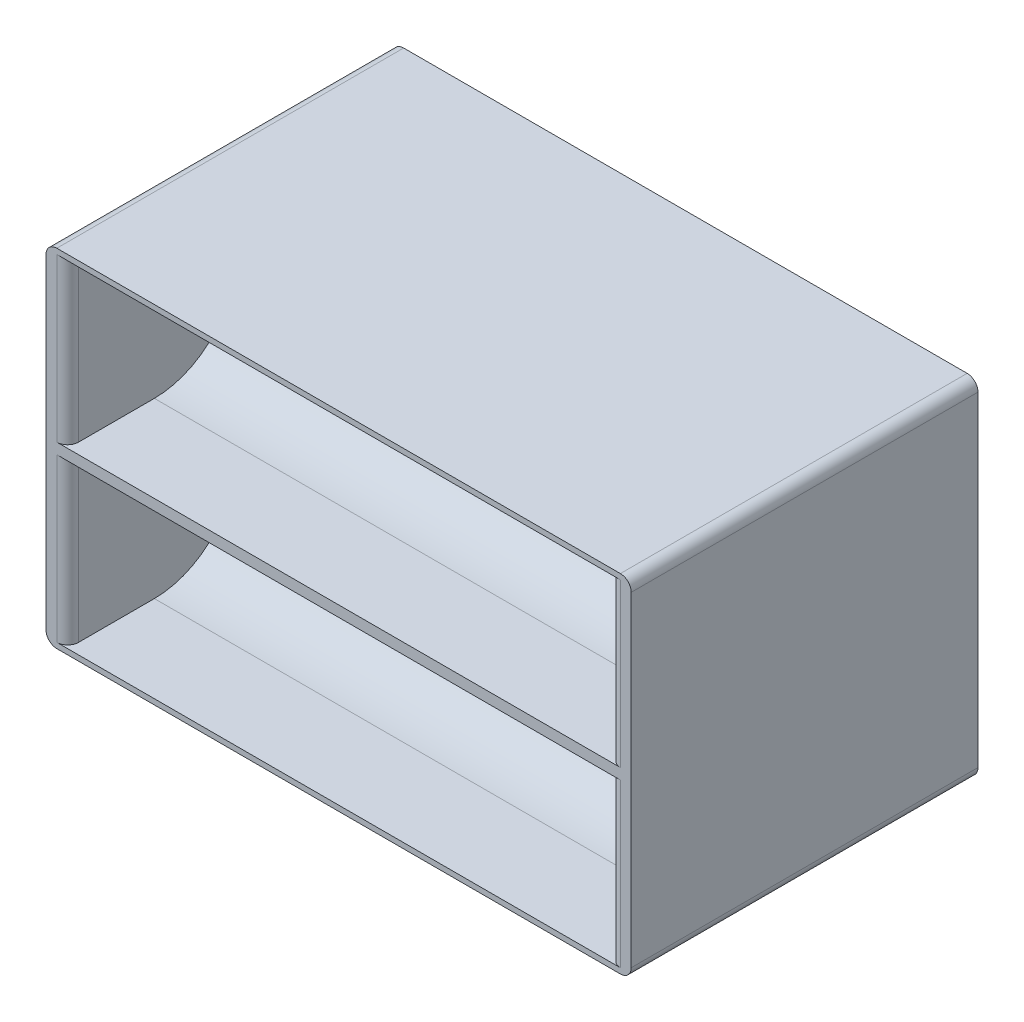
from build123d import *

# Parameters (mm, degrees)
SKETCH1_W               = 54
SKETCH1_H               = 32
BOSS_EXTRUDE1_DEPTH     = 32
CUT_EXTRUDE1_DEPTH      = 25
CUT_EXTRUDE1_DEPTH_BACK = 25
FILLET1_R               = 1


with BuildPart() as part:
    # Sketch1 → Boss-Extrude1 (new body)
    with BuildSketch(Plane(origin=(0, 0, 0), x_dir=(1, 0, 0), z_dir=(0, 1, 0))):
        Rectangle(SKETCH1_W, SKETCH1_H)
    extrude(amount=BOSS_EXTRUDE1_DEPTH)

    # Sketch2 → Cut-Extrude1 (cut, two sides: drawn at the far end of the back side and taken through both)
    with BuildSketch(Plane(origin=(0, 0, 0), x_dir=(0, 0, -1), z_dir=(1, 0, 0)).offset(-CUT_EXTRUDE1_DEPTH_BACK)):
        with BuildLine():
            Line((-8, 31.5), (-16, 31.5))
            Line((-16, 31.5), (-16, 16.5))
            Line((-16, 16.5), (-8, 16.5))
            ThreePointArc((-8, 16.5), (-0.5, 24), (-8, 31.5))
        make_face()
        with BuildLine():
            Line((16, 16.5), (8, 16.5))
            ThreePointArc((8, 16.5), (0.5, 24), (8, 31.5))
            Line((8, 31.5), (16, 31.5))
            Line((16, 31.5), (16, 16.5))
        make_face()
        with BuildLine():
            Line((16, 0.5), (16, 15.5))
            Line((16, 15.5), (8, 15.5))
            ThreePointArc((8, 15.5), (0.5, 8), (8, 0.5))
            Line((8, 0.5), (16, 0.5))
        make_face()
        with BuildLine():
            Line((-16, 15.5), (-8, 15.5))
            ThreePointArc((-8, 15.5), (-0.5, 8), (-8, 0.5))
            Line((-8, 0.5), (-16, 0.5))
            Line((-16, 0.5), (-16, 15.5))
        make_face()
    extrude(amount=CUT_EXTRUDE1_DEPTH + CUT_EXTRUDE1_DEPTH_BACK, mode=Mode.SUBTRACT)

    # Fillet1
    fillet1_edges = [part.edges().sort_by_distance(p)[0] for p in [
        (27, 32, 0),
        (-25, 24, -16),
        (25, 24, -16),
        (-25, 8, -16),
        (25, 8, -16),
        (-25, 24, 16),
        (25, 24, 16),
        (-27, 32, 0),
        (-25, 8, 16),
        (27, 0, 0),
        (25, 8, 16),
        (-27, 0, 0),
    ]]
    fillet(fillet1_edges, radius=FILLET1_R - 0.0001)  # a hair under: the kernel refuses the full size


solid = part.part
